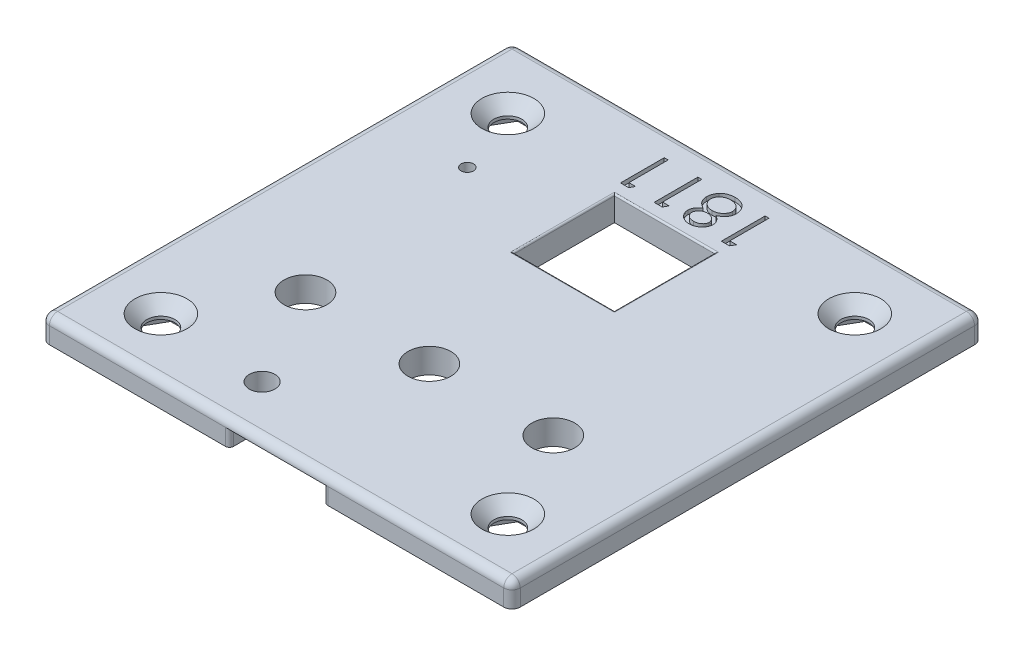
from build123d import *

# Parameters (mm, degrees)
ESQUISSE1_W                                 = 57
ESQUISSE1_H                                 = 57
BOSS_EXTRU_1_DEPTH                          = 3
ESQUISSE2_R                                 = 1.7
ENL_V_MAT_EXTRU_1_DEPTH                     = 3
ESQUISSE3_R                                 = 1.55
ENL_V_MAT_EXTRU_2_DEPTH                     = 3
ESQUISSE4_R                                 = 2.6
ESQUISSE4_W                                 = 12.2
ESQUISSE4_H                                 = 12.2
ENL_V_MAT_EXTRU_3_DEPTH                     = 3
CONG_1_R                                    = 1
CONG_2_R                                    = 1
CONG_3_R                                    = 1
CONG_4_R                                    = 1
CONG_5_R                                    = 0.2
CONG_6_R                                    = 0.2
CONG_7_R                                    = 0.2
CONG_8_R                                    = 0.2
ESQUISSE11_R                                = 0.75
ENL_V_MAT_EXTRU_5_DEPTH                     = 3
ESQUISSE12_W                                = 11.4
ESQUISSE12_H                                = 2
ENL_V_MAT_EXTRU_6_DEPTH                     = 2
ENL_V_MAT_EXTRU_7_DEPTH                     = 0.5
CONG_9_R                                    = 0.5
CONG_11_R                                   = 0.5
FRAISAGE_POUR_VIS_T_TE_FRAIS_E_M31_AT_COUNT = 2
FRAISAGE_POUR_VIS_T_TE_FRAIS_E_M31_AT_PITCH = 42
FRAISAGE_POUR_VIS_T_TE_FRAIS_E_M31_2_COUNT  = 2
FRAISAGE_POUR_VIS_T_TE_FRAIS_E_M31_2_PITCH  = 42
FRAISAGE_POUR_VIS_T_TE_FRAIS_E_M31_3_COUNT  = 2
FRAISAGE_POUR_VIS_T_TE_FRAIS_E_M31_3_PITCH  = 59.39696962
ENL_V_MAT_EXTRU_8_DEPTH                     = 1.2
ENL_V_MAT_EXTRU_9_DEPTH                     = 1.2
ENL_V_MAT_EXTRU_10_DEPTH                    = 1.2
ENL_V_MAT_EXTRU_11_DEPTH                    = 1.2
ESQUISSE22_W                                = 5
ESQUISSE22_H                                = 11.04
ENL_V_MAT_EXTRU_12_DEPTH                    = 1


with BuildPart() as part:
    # Esquisse1 → Boss.-Extru.1 (new body)
    with BuildSketch(Plane(origin=(0, 0, 0), x_dir=(1, 0, 0), z_dir=(0, 1, 0))):
        with Locations((-1.479849302, 11.898984053)):
            Rectangle(ESQUISSE1_W, ESQUISSE1_H)
    extrude(amount=BOSS_EXTRU_1_DEPTH)

    # Esquisse2 → Enlèv. mat.-Extru.1 (cut)
    with BuildSketch(Plane(origin=(0, 3, 0), x_dir=(1, 0, 0), z_dir=(0, 1, 0))):
        with Locations(Location((19.520150698, -9.601015947, 0), (0, 0, 270))):
            Circle(ESQUISSE2_R)
        with Locations(Location((-22.479849302, -9.601015947, 0), (0, 0, 270))):
            Circle(ESQUISSE2_R)
        with Locations(Location((-22.479849302, 32.398984053, 0), (0, 0, 270))):
            Circle(ESQUISSE2_R)
        with Locations(Location((19.520150698, 32.398984053, 0), (0, 0, 270))):
            Circle(ESQUISSE2_R)
    extrude(amount=-ENL_V_MAT_EXTRU_1_DEPTH, mode=Mode.SUBTRACT)

    # Esquisse3 → Enlèv. mat.-Extru.2 (cut)
    with BuildSketch(Plane(origin=(0, 3, 0), x_dir=(1, 0, 0), z_dir=(0, 1, 0))):
        with Locations(Location((-9.229849302, -10.601015947, 0), (0, 0, 270))):
            Circle(ESQUISSE3_R)
    extrude(amount=-ENL_V_MAT_EXTRU_2_DEPTH, mode=Mode.SUBTRACT)

    # Esquisse4 → Enlèv. mat.-Extru.3 (cut)
    with BuildSketch(Plane(origin=(0, 3, 0), x_dir=(1, 0, 0), z_dir=(0, 1, 0))):
        with Locations(Location((-0.979849302, 1.398984053, 0), (0, 0, 270))):
            Circle(ESQUISSE4_R)
        with Locations(Location((-15.979849302, 1.398984053, 0), (0, 0, 270))):
            Circle(ESQUISSE4_R)
        with Locations(Location((14.020150698, 1.398984053, 0), (0, 0, 270))):
            Circle(ESQUISSE4_R)
        with Locations((-1.479849302, 24.298984053)):
            Rectangle(ESQUISSE4_W, ESQUISSE4_H)
    extrude(amount=-ENL_V_MAT_EXTRU_3_DEPTH, mode=Mode.SUBTRACT)

    # Congé1
    cong_1_edges = [part.edges().sort_by_distance(p)[0] for p in [
        (-1.479849302, 3, 16.601015947),
    ]]
    fillet(cong_1_edges, radius=CONG_1_R)

    # Congé2
    cong_2_edges = [part.edges().sort_by_distance(p)[0] for p in [
        (-29.979849302, 3, -12.398984053),
        (-29.979849302, 1, 16.601015947),
        (-29.979849302, 2.707106781, 16.308122729),
    ]]
    fillet(cong_2_edges, radius=CONG_2_R)

    # Congé3
    cong_3_edges = [part.edges().sort_by_distance(p)[0] for p in [
        (27.020150698, 3, -12.398984053),
        (27.020150698, 1, 16.601015947),
        (27.020150698, 2.707106781, 16.308122729),
    ]]
    fillet(cong_3_edges, radius=CONG_3_R)

    # Congé4
    cong_4_edges = [part.edges().sort_by_distance(p)[0] for p in [
        (-29.979849302, 1, -40.398984053),
        (-29.686956083, 2.707106781, -40.398984053),
        (27.020150698, 1, -40.398984053),
        (-1.479849302, 3, -40.398984053),
        (26.727257479, 2.707106781, -40.398984053),
    ]]
    fillet(cong_4_edges, radius=CONG_4_R)

    # Congé5
    cong_5_edges = [part.edges().sort_by_distance(p)[0] for p in [
        (-1.479849302, 3, -30.398984053),
    ]]
    fillet(cong_5_edges, radius=CONG_5_R)

    # Congé6
    cong_6_edges = [part.edges().sort_by_distance(p)[0] for p in [
        (-7.579849302, 3, -24.398984053),
    ]]
    fillet(cong_6_edges, radius=CONG_6_R)

    # Congé7
    cong_7_edges = [part.edges().sort_by_distance(p)[0] for p in [
        (4.620150698, 3, -24.398984053),
    ]]
    fillet(cong_7_edges, radius=CONG_7_R)

    # Congé8
    cong_8_edges = [part.edges().sort_by_distance(p)[0] for p in [
        (-1.479849302, 3, -18.198984053),
    ]]
    fillet(cong_8_edges, radius=CONG_8_R)

    # Esquisse11 → Enlèv. mat.-Extru.5 (cut)
    with BuildSketch(Plane(origin=(0, 3, 0), x_dir=(1, 0, 0), z_dir=(0, 1, 0))):
        with Locations(Location((-19.279849302, 24.288984053, 0), (0, 0, 270))):
            Circle(ESQUISSE11_R)
    extrude(amount=-ENL_V_MAT_EXTRU_5_DEPTH, mode=Mode.SUBTRACT)

    # Esquisse12 → Enlèv. mat.-Extru.6 (cut)
    with BuildSketch(Plane.XY.offset(16.601015947)):
        with Locations((-1.479849302, 1)):
            Rectangle(ESQUISSE12_W, ESQUISSE12_H)
    extrude(amount=-ENL_V_MAT_EXTRU_6_DEPTH, mode=Mode.SUBTRACT)

    # Esquisse13 → Enlèv. mat.-Extru.7 (cut)
    # profile 1 of 4: a face of its own
    with BuildSketch(Plane(origin=(0, 3, 0), x_dir=(1, 0, 0), z_dir=(0, 1, 0))):
        Polygon((-7.397806026, 31.931756641), (-8.376213144, 31.931756641), (-8.376213144, 37.223423308), (-7.901319982, 37.223423308), (-7.901319982, 32.474491684), (-7.087217417, 32.474491684), align=None)
    # profile 2 of 4: a face of its own
    with BuildSketch(Plane(origin=(0, 3, 0), x_dir=(1, 0, 0), z_dir=(0, 1, 0))):
        Polygon((-3.327293205, 31.931756641), (-4.305700323, 31.931756641), (-4.305700323, 37.223423308), (-3.830807161, 37.223423308), (-3.830807161, 32.474491684), (-3.016704597, 32.474491684), align=None)
    # profile 3 of 4: a face of its own
    with BuildSketch(Plane(origin=(0, 3, 0), x_dir=(1, 0, 0), z_dir=(0, 1, 0))):
        with BuildLine():
            add(Edge.make_bspline(
                [(-0.704780518, 34.275481601), (-0.74774962, 34.298062284), (-0.831815862, 34.342239915), (-0.951571404, 34.413588167), (-1.063344195, 34.486182521), (-1.165066926, 34.562633032), (-1.257736887, 34.641314631), (-1.341639258, 34.72201912), (-1.417676359, 34.804491263), (-1.48323598, 34.890851263), (-1.541404223, 34.979563385), (-1.590679861, 35.071720985), (-1.633684978, 35.165992371), (-1.667438637, 35.263808774), (-1.69530615, 35.363828292), (-1.714466254, 35.467393019), (-1.724773917, 35.573806819), (-1.726722325, 35.645725645), (-1.72770887, 35.682140589)],
                knots=[0, 0, 0, 0, 1.264219729, 2.473363326, 3.62979159, 4.734286947, 5.785533755, 6.79450939, 7.765315851, 8.704182021, 9.615576613, 10.525715488, 11.423813905, 12.311666436, 13.218214638, 14.126256791, 15.051260205, 16, 16, 16, 16], degree=3))
            add(Edge.make_bspline(
                [(-1.72770887, 35.682140589), (-1.726549093, 35.733090546), (-1.724253459, 35.83393963), (-1.704050108, 35.982748857), (-1.674207086, 36.12785806), (-1.628872678, 36.267622259), (-1.573086535, 36.403232272), (-1.502691798, 36.532861068), (-1.423242224, 36.660229692), (-1.359348069, 36.738570626), (-1.327017765, 36.778210968)],
                knots=[0, 0, 0, 0, 1.02531512, 2.029483338, 3.018748588, 4.004195107, 4.983200899, 5.966616707, 6.971112471, 8, 8, 8, 8], degree=3))
            add(Edge.make_bspline(
                [(-1.327017765, 36.778210968), (-1.284931667, 36.824465841), (-1.20127954, 36.916404002), (-1.05797678, 37.035770108), (-0.900705599, 37.136084073), (-0.730074548, 37.217835628), (-0.54653974, 37.281465438), (-0.350140281, 37.327189245), (-0.140493288, 37.353379108), (0.003599508, 37.357164902), (0.077521164, 37.359107068)],
                knots=[0, 0, 0, 0, 0.954267603, 1.896743057, 2.838368354, 3.796610408, 4.779680527, 5.799409237, 6.871065594, 8, 8, 8, 8], degree=3))
            add(Edge.make_bspline(
                [(0.077521164, 37.359107068), (0.148599293, 37.357359955), (0.286910113, 37.353960251), (0.488254679, 37.331052094), (0.676167298, 37.290495898), (0.851538907, 37.236134288), (1.012673714, 37.163641788), (1.159864697, 37.074787145), (1.295269206, 36.971576405), (1.414639433, 36.851525687), (1.520587092, 36.722914742), (1.613735872, 36.590271785), (1.690723047, 36.453693355), (1.757079807, 36.315256952), (1.806462114, 36.172157561), (1.841487307, 36.025863708), (1.863488014, 35.876790998), (1.866430499, 35.776204353), (1.867910788, 35.725601793)],
                knots=[0, 0, 0, 0, 1.256864279, 2.445730223, 3.576845088, 4.651810441, 5.686528262, 6.692706664, 7.686234615, 8.689148594, 9.678739427, 10.630299996, 11.55097961, 12.448208961, 13.341360817, 14.221834469, 15.105450545, 16, 16, 16, 16], degree=3))
            add(Edge.make_bspline(
                [(1.867910788, 35.725601793), (1.867036873, 35.688470717), (1.865309708, 35.615086606), (1.853361424, 35.506667723), (1.834135978, 35.401147091), (1.80808373, 35.298108213), (1.77245273, 35.19809477), (1.730181654, 35.100590979), (1.680418453, 35.005599665), (1.621203587, 34.914567046), (1.555964157, 34.824268528), (1.478518951, 34.739187846), (1.394031198, 34.654327479), (1.297471313, 34.574847779), (1.194054243, 34.494182607), (1.078956856, 34.419074146), (0.956016967, 34.343660542), (0.868616511, 34.298597849), (0.823781848, 34.275481601)],
                knots=[0, 0, 0, 0, 0.941575622, 1.860885767, 2.762557628, 3.660168386, 4.552890429, 5.45184204, 6.353736508, 7.268493418, 8.204037487, 9.175167802, 10.182660057, 11.238220596, 12.344046335, 13.507168087, 14.721227736, 16, 16, 16, 16], degree=3))
            add(Edge.make_bspline(
                [(0.823781848, 34.275481601), (0.885077427, 34.241918734), (1.003577232, 34.177033251), (1.161982794, 34.059307648), (1.2961657, 33.929493262), (1.404699944, 33.78739474), (1.490393224, 33.637682364), (1.550979352, 33.481144291), (1.590525301, 33.319526443), (1.594531342, 33.209319114), (1.596543266, 33.153970516)],
                knots=[0, 0, 0, 0, 1.16701039, 2.256125286, 3.287752239, 4.277689688, 5.235169525, 6.160862735, 7.076343936, 8, 8, 8, 8], degree=3))
            add(Edge.make_bspline(
                [(1.596543266, 33.153970516), (1.594066275, 33.097582762), (1.58908709, 32.984233543), (1.548963171, 32.81545565), (1.483081813, 32.649597859), (1.395008244, 32.487044525), (1.282923743, 32.33520256), (1.150256071, 32.197915564), (0.997172114, 32.078736672), (0.827036606, 31.977991336), (0.644274127, 31.895603869), (0.451118195, 31.839359182), (0.251011322, 31.802367003), (0.114789605, 31.798190512), (0.045720283, 31.79607288)],
                knots=[0, 0, 0, 0, 0.888724595, 1.786491426, 2.720083884, 3.697804067, 4.69440576, 5.687697823, 6.7000873, 7.744853364, 8.800284131, 9.853047784, 10.91141782, 12, 12, 12, 12], degree=3))
            add(Edge.make_bspline(
                [(0.045720283, 31.79607288), (-0.021567758, 31.798250165), (-0.154252109, 31.802543523), (-0.349575741, 31.838704958), (-0.536623781, 31.898423353), (-0.714347896, 31.979760025), (-0.878966502, 32.081107898), (-1.025461823, 32.20159834), (-1.155029777, 32.337389434), (-1.262076294, 32.489732205), (-1.347950212, 32.6522747), (-1.409789325, 32.820884928), (-1.448884515, 32.993541513), (-1.453852351, 33.110308181), (-1.456341349, 33.168810928)],
                knots=[0, 0, 0, 0, 1.072634126, 2.115112298, 3.156050586, 4.19761425, 5.225177188, 6.230426315, 7.215180151, 8.209739481, 9.190420596, 10.139012357, 11.067603024, 12, 12, 12, 12], degree=3))
            add(Edge.make_bspline(
                [(-1.456341349, 33.168810928), (-1.454159309, 33.226222986), (-1.449873907, 33.338977006), (-1.414299129, 33.503109412), (-1.353455213, 33.656504492), (-1.271376579, 33.801522663), (-1.1636465, 33.935846545), (-1.032440149, 34.060143235), (-0.879460079, 34.176843717), (-0.764308583, 34.241867351), (-0.704780518, 34.275481601)],
                knots=[0, 0, 0, 0, 0.975463758, 1.915755378, 2.838359076, 3.772025586, 4.738400888, 5.753889765, 6.838863581, 8, 8, 8, 8], degree=3))
        make_face()
        with BuildLine():
            add(Edge.make_bspline(
                [(0.072221017, 32.338807923), (0.109340795, 32.339789651), (0.18196331, 32.341710339), (0.288426584, 32.351822224), (0.389747799, 32.371245569), (0.486481018, 32.397855289), (0.578957614, 32.430963113), (0.665056932, 32.474583799), (0.7476724, 32.523068373), (0.824093744, 32.579938571), (0.893274463, 32.641985187), (0.955065042, 32.706783104), (1.005405187, 32.776242537), (1.048714658, 32.846888521), (1.080877991, 32.921651276), (1.103725713, 32.998893849), (1.119895224, 33.079105487), (1.121060597, 33.133749134), (1.121650104, 33.161390722)],
                knots=[0, 0, 0, 0, 1.20353747, 2.354645537, 3.462130888, 4.543058862, 5.604822423, 6.639552563, 7.666902586, 8.706944258, 9.720926464, 10.677177239, 11.602682187, 12.496457588, 13.358248655, 14.231532794, 15.105417644, 16, 16, 16, 16], degree=3))
            add(Edge.make_bspline(
                [(1.121650104, 33.161390722), (1.120574982, 33.189016659), (1.118450386, 33.243609479), (1.103072489, 33.324550954), (1.077360516, 33.403056388), (1.042103872, 33.479858646), (0.99685857, 33.554760594), (0.941944285, 33.628049252), (0.8749783, 33.697786558), (0.801027644, 33.765951097), (0.720249639, 33.828752094), (0.63536665, 33.884849382), (0.545759195, 33.929569646), (0.454110809, 33.968780178), (0.358483346, 33.998192624), (0.259536165, 34.019382559), (0.15737496, 34.032489855), (0.088160257, 34.034060334), (0.053140489, 34.034854932)],
                knots=[0, 0, 0, 0, 0.873213166, 1.72559466, 2.594724523, 3.479581045, 4.391597569, 5.35687048, 6.368548091, 7.443976143, 8.534559525, 9.600545123, 10.654815915, 11.696401765, 12.749428718, 13.812189468, 14.893058657, 16, 16, 16, 16], degree=3))
            add(Edge.make_bspline(
                [(0.053140489, 34.034854932), (0.008158472, 34.033541895), (-0.081361277, 34.030928789), (-0.213279491, 34.006411343), (-0.341869272, 33.96833343), (-0.464697482, 33.914288715), (-0.579565784, 33.848395222), (-0.683234419, 33.770688352), (-0.771365047, 33.679343219), (-0.846341783, 33.579658534), (-0.904962976, 33.473917166), (-0.949867729, 33.367368806), (-0.976312664, 33.259135822), (-0.979750289, 33.186611402), (-0.981448187, 33.150790428)],
                knots=[0, 0, 0, 0, 1.076561449, 2.142489767, 3.202892658, 4.283174188, 5.348766409, 6.369549039, 7.375093932, 8.378927502, 9.349008457, 10.26378795, 11.142457041, 12, 12, 12, 12], degree=3))
            add(Edge.make_bspline(
                [(-0.981448187, 33.150790428), (-0.980658882, 33.12564515), (-0.979092226, 33.075735375), (-0.965659091, 33.00179076), (-0.944707502, 32.929482257), (-0.9141676, 32.859234353), (-0.877223825, 32.789415124), (-0.830132512, 32.722214863), (-0.775556368, 32.655599904), (-0.712707506, 32.591762912), (-0.641701256, 32.53183103), (-0.56196323, 32.479879476), (-0.474197092, 32.43655766), (-0.379579484, 32.400161981), (-0.277110501, 32.373130604), (-0.167672379, 32.352788513), (-0.050277651, 32.341346584), (0.030502514, 32.339672497), (0.072221017, 32.338807923)],
                knots=[0, 0, 0, 0, 0.814035228, 1.61574325, 2.427118093, 3.24780647, 4.092880925, 4.981933388, 5.900917883, 6.880367106, 7.87994501, 8.905470125, 9.95492938, 11.0455354, 12.184050453, 13.382997595, 14.64846247, 16, 16, 16, 16], degree=3))
        make_face(mode=Mode.SUBTRACT)
        with BuildLine():
            add(Edge.make_bspline(
                [(0.041480165, 34.577589974), (0.08853926, 34.578427266), (0.18085772, 34.580069829), (0.316109903, 34.598344618), (0.445905061, 34.623801378), (0.569844748, 34.662356992), (0.687292764, 34.712523084), (0.799901974, 34.772011477), (0.90590895, 34.843314193), (1.004839876, 34.92470222), (1.095413795, 35.012900467), (1.175165397, 35.106049599), (1.242544192, 35.202884765), (1.297222841, 35.303528446), (1.339641089, 35.407758895), (1.370946411, 35.515636937), (1.38912224, 35.627463483), (1.391711924, 35.703277372), (1.393017625, 35.741502234)],
                knots=[0, 0, 0, 0, 1.140332253, 2.237053636, 3.304055028, 4.344690294, 5.377465719, 6.397042765, 7.428360044, 8.469453732, 9.499453352, 10.490108612, 11.438398528, 12.354680514, 13.261581007, 14.161901135, 15.073242693, 16, 16, 16, 16], degree=3))
            add(Edge.make_bspline(
                [(1.393017625, 35.741502234), (1.39091842, 35.789014468), (1.386738401, 35.88362267), (1.35476618, 36.023091959), (1.302258551, 36.15807346), (1.228596537, 36.28666347), (1.138746102, 36.407302892), (1.029515373, 36.513940513), (0.90356751, 36.605140826), (0.761937234, 36.681365577), (0.60668272, 36.741736614), (0.438763413, 36.784927971), (0.259316742, 36.812075564), (0.135569069, 36.814917302), (0.072221017, 36.816372026)],
                knots=[0, 0, 0, 0, 0.899105568, 1.790333855, 2.694925079, 3.632758987, 4.588257081, 5.534574046, 6.511571685, 7.523527334, 8.572244311, 9.657983075, 10.801090915, 12, 12, 12, 12], degree=3))
            add(Edge.make_bspline(
                [(0.072221017, 36.816372026), (0.022709013, 36.815410224), (-0.073756249, 36.813536327), (-0.214540875, 36.797339897), (-0.347086109, 36.770883406), (-0.472661775, 36.735011242), (-0.590333187, 36.687459543), (-0.699939953, 36.628395775), (-0.802974619, 36.560932187), (-0.895033682, 36.481061132), (-0.978738003, 36.395594163), (-1.05205639, 36.30559462), (-1.114106293, 36.211963855), (-1.164124475, 36.114756674), (-1.20384369, 36.014330308), (-1.232476722, 35.910272506), (-1.250124066, 35.802174538), (-1.251910284, 35.728849105), (-1.252815708, 35.691680853)],
                knots=[0, 0, 0, 0, 1.224631902, 2.385975653, 3.500340538, 4.565441647, 5.612488581, 6.63322211, 7.641830068, 8.652595074, 9.641693811, 10.598750962, 11.520088299, 12.415429315, 13.298523938, 14.187139574, 15.081071174, 16, 16, 16, 16], degree=3))
            add(Edge.make_bspline(
                [(-1.252815708, 35.691680853), (-1.2514552, 35.655576477), (-1.248772515, 35.584384956), (-1.231501288, 35.478964229), (-1.201852303, 35.376697194), (-1.158619084, 35.278045098), (-1.105526496, 35.181860364), (-1.039940207, 35.088950473), (-0.962659584, 34.999058164), (-0.873873785, 34.914034223), (-0.77765003, 34.835433448), (-0.675673859, 34.765582653), (-0.567480534, 34.708492958), (-0.455213322, 34.660533594), (-0.337740472, 34.623158556), (-0.215628592, 34.596950689), (-0.088646349, 34.580479061), (-0.002385376, 34.578563883), (0.041480165, 34.577589974)],
                knots=[0, 0, 0, 0, 0.917336384, 1.808827106, 2.706624561, 3.615530867, 4.539869921, 5.493819324, 6.499753197, 7.547410123, 8.613069608, 9.653934021, 10.682176708, 11.716048074, 12.752411263, 13.808993382, 14.885826486, 16, 16, 16, 16], degree=3))
        make_face(mode=Mode.SUBTRACT)
    # profile 4 of 4: a face of its own
    with BuildSketch(Plane(origin=(0, 3, 0), x_dir=(1, 0, 0), z_dir=(0, 1, 0))):
        Polygon((4.813732436, 31.931756641), (3.835325318, 31.931756641), (3.835325318, 37.223423308), (4.31021848, 37.223423308), (4.31021848, 32.474491684), (5.124321044, 32.474491684), align=None)
    extrude(amount=-ENL_V_MAT_EXTRU_7_DEPTH, mode=Mode.SUBTRACT)

    # Congé9
    cong_9_edges = [part.edges().sort_by_distance(p)[0] for p in [
        (4.220150698, 1, 16.601015947),
    ]]
    fillet(cong_9_edges, radius=CONG_9_R)

    # Congé11
    # the kernel refuses this fillet: 0.5 mm, written as the material it takes off along each edge
    with BuildSketch(Plane(origin=(-7.179849302, 2, 16.601015947), x_dir=(0, 0, -1), z_dir=(0, -1, 0))) as cong_11_piece_1:
        with BuildLine():
            CenterArc((CONG_11_R, -CONG_11_R), CONG_11_R, 90, 90)
            Line((0, -CONG_11_R), (0, 0))
            Line((0, 0), (CONG_11_R, 0))
        make_face()
    extrude(amount=3.25, mode=Mode.SUBTRACT)

    # Esquisse17 → Fraisage pour vis à tête fraisée M31 (revolve, cut)
    with BuildSketch(Plane(origin=(-22.479849302, 3, -32.398984053), x_dir=(0, 0, 1), z_dir=(1, 0, 0))):
        Polygon((0, 0), (0, 3), (1.7, 3), (1.7, 1.45), (3.15, 0), align=None)
    fraisage_pour_vis_t_te_frais_e_m31 = revolve(axis=Axis((-22.479849302, 9.35, -32.398984053), (0, -1, 0)), mode=Mode.SUBTRACT)

    # Fraisage pour vis à tête fraisée M31 at: Fraisage pour vis à tête fraisée M31 ×2
    with Locations(*[(0, 0, i * FRAISAGE_POUR_VIS_T_TE_FRAIS_E_M31_AT_PITCH) for i in range(1, FRAISAGE_POUR_VIS_T_TE_FRAIS_E_M31_AT_COUNT)]):
        add(fraisage_pour_vis_t_te_frais_e_m31, mode=Mode.SUBTRACT)

    # Fraisage pour vis _ t_te frais_e M31 2: Fraisage pour vis à tête fraisée M31 ×2
    with Locations(*[(i * FRAISAGE_POUR_VIS_T_TE_FRAIS_E_M31_2_PITCH, 0, 0) for i in range(1, FRAISAGE_POUR_VIS_T_TE_FRAIS_E_M31_2_COUNT)]):
        add(fraisage_pour_vis_t_te_frais_e_m31, mode=Mode.SUBTRACT)

    # Fraisage pour vis _ t_te frais_e M31 3: Fraisage pour vis à tête fraisée M31 ×2
    with Locations(*[Vector(0.7071067811865477, 0, 0.7071067811865474) * (i * FRAISAGE_POUR_VIS_T_TE_FRAIS_E_M31_3_PITCH) for i in range(1, FRAISAGE_POUR_VIS_T_TE_FRAIS_E_M31_3_COUNT)]):
        add(fraisage_pour_vis_t_te_frais_e_m31, mode=Mode.SUBTRACT)

    # Esquisse18 → Enlèv. mat.-Extru.8 (cut)
    with BuildSketch(Plane(origin=(0, 0, 0), x_dir=(-1, 0, 0), z_dir=(0, -1, 0))):
        Polygon((24.079849302, -12.372297239), (25.679849302, -9.601015947), (24.079849302, -6.829734655), (20.879849302, -6.829734655), (19.279849302, -9.601015947), (20.879849302, -12.372297239), align=None)
    extrude(amount=-ENL_V_MAT_EXTRU_8_DEPTH, mode=Mode.SUBTRACT)

    # Esquisse19 → Enlèv. mat.-Extru.9 (cut)
    with BuildSketch(Plane(origin=(0, 0, 0), x_dir=(-1, 0, 0), z_dir=(0, -1, 0))):
        Polygon((24.079849302, 35.170265345), (20.879849302, 35.170265345), (19.279849302, 32.398984053), (20.879849302, 29.627702761), (24.079849302, 29.627702761), (25.679849302, 32.398984053), align=None)
    extrude(amount=-ENL_V_MAT_EXTRU_9_DEPTH, mode=Mode.SUBTRACT)

    # Esquisse20 → Enlèv. mat.-Extru.10 (cut)
    with BuildSketch(Plane(origin=(0, 0, 0), x_dir=(-1, 0, 0), z_dir=(0, -1, 0))):
        Polygon((-17.920150698, 35.170265345), (-21.120150698, 35.170265345), (-22.720150698, 32.398984053), (-21.120150698, 29.627702761), (-17.920150698, 29.627702761), (-16.320150698, 32.398984053), align=None)
    extrude(amount=-ENL_V_MAT_EXTRU_10_DEPTH, mode=Mode.SUBTRACT)

    # Esquisse21 → Enlèv. mat.-Extru.11 (cut)
    with BuildSketch(Plane(origin=(0, 0, 0), x_dir=(-1, 0, 0), z_dir=(0, -1, 0))):
        Polygon((-21.120150698, -6.829734655), (-22.720150698, -9.601015947), (-21.120150698, -12.372297239), (-17.920150698, -12.372297239), (-16.320150698, -9.601015947), (-17.920150698, -6.829734655), align=None)
    extrude(amount=-ENL_V_MAT_EXTRU_11_DEPTH, mode=Mode.SUBTRACT)

    # Esquisse22 → Enlèv. mat.-Extru.12 (cut)
    with BuildSketch(Plane(origin=(0, 0, 0), x_dir=(-1, 0, 0), z_dir=(0, -1, 0))):
        with Locations((-7.720150698, 4.698984053)):
            Rectangle(ESQUISSE22_W, ESQUISSE22_H)
    extrude(amount=-ENL_V_MAT_EXTRU_12_DEPTH, mode=Mode.SUBTRACT)


solid = part.part
